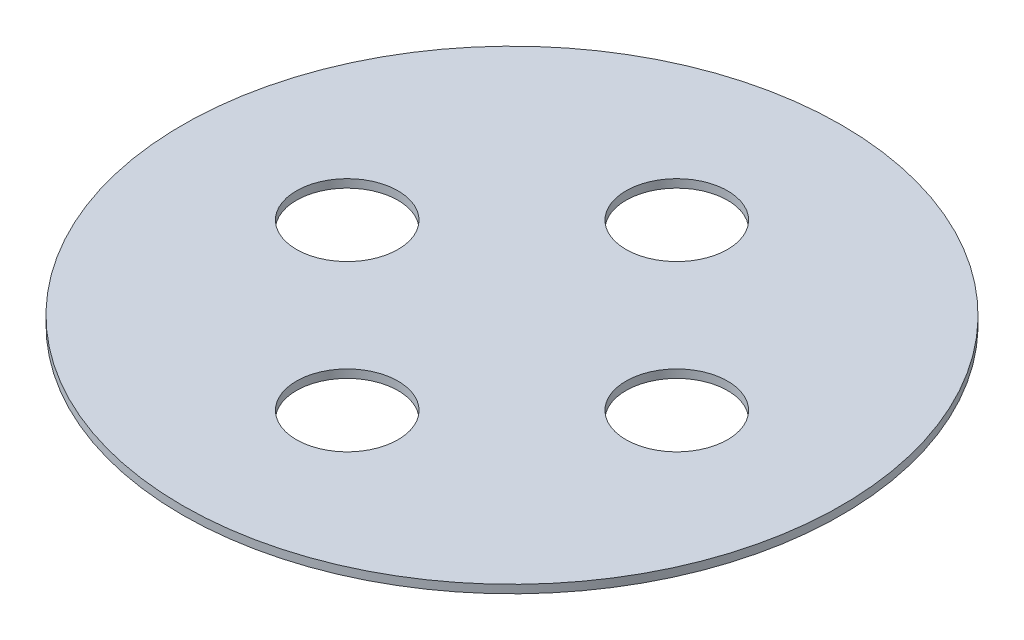
from build123d import *

# Parameters (mm, degrees)
SKETCH_1_R          = 9.9
SKETCH_1_R_2        = 1.85
EXTRUDE_1_DEPTH     = 7
SKETCH_2_R          = 12.5
SKETCH_2_R_2        = 1.85
EXTRUDE_2_DEPTH     = 2.5
SKETCH_3_R          = 3.75
EXTRUDE_3_DEPTH     = 6.3
CHAMFER_1_SIZE      = 2
SKETCH_4_R          = 41.5
CUT_EXTRUDE_1_DEPTH = 15.5
EXTRUDE_START       = -0.3
SKETCH_5_R          = 12
SKETCH_5_R_2        = 9.9
EXTRUDE_4_DEPTH     = 0.3


with BuildPart() as part:
    # 草图1 → 凸台-拉伸1 (new body)
    with BuildSketch(Plane(origin=(0, 0, 0), x_dir=(1, 0, 0), z_dir=(0, 1, 0))):
        with Locations(Location((0, 0, 0), (0, 0, 270))):
            Circle(SKETCH_1_R)
        with Locations(Location((6, 0, 0), (0, 0, 270))):
            Circle(SKETCH_1_R_2, mode=Mode.SUBTRACT)
        with Locations(Location((0, -6, 0), (0, 0, 270))):
            Circle(SKETCH_1_R_2, mode=Mode.SUBTRACT)
        with Locations(Location((-6, 0, 0), (0, 0, 270))):
            Circle(SKETCH_1_R_2, mode=Mode.SUBTRACT)
        with Locations(Location((0, 6, 0), (0, 0, 270))):
            Circle(SKETCH_1_R_2, mode=Mode.SUBTRACT)
    extrude(amount=EXTRUDE_1_DEPTH)

    # 草图2 → 凸台-拉伸2 (add)
    with BuildSketch(Plane(origin=(0, 7, 0), x_dir=(1, 0, 0), z_dir=(0, 1, 0))):
        with Locations(Location((0, 0, 0), (0, 0, 270))):
            Circle(SKETCH_2_R)
        with Locations(Location((-6, 0, 0), (0, 0, 270))):
            Circle(SKETCH_2_R_2, mode=Mode.SUBTRACT)
        with Locations(Location((0, -6, 0), (0, 0, 270))):
            Circle(SKETCH_2_R_2, mode=Mode.SUBTRACT)
        with Locations(Location((6, 0, 0), (0, 0, 270))):
            Circle(SKETCH_2_R_2, mode=Mode.SUBTRACT)
        with Locations(Location((0, 6, 0), (0, 0, 270))):
            Circle(SKETCH_2_R_2, mode=Mode.SUBTRACT)
    extrude(amount=EXTRUDE_2_DEPTH)

    # 草图3 → 凸台-拉伸3 (add)
    # profile 1 of 8: a face of its own
    with BuildSketch(Plane(origin=(0, 9.5, 0), x_dir=(1, 0, 0), z_dir=(0, 1, 0))):
        with BuildLine():
            Line((2.25, 0), (-2.25, 0))
            ThreePointArc((-2.25, 0), (-6, -3.75), (-9.75, 0))
            Line((-9.75, 0), (-12.5, 0))
            ThreePointArc((-12.5, 0), (-3.952847075, -11.858541226), (10, -7.5))
            ThreePointArc((10, -7.5), (11.858541226, -3.952847075), (12.5, 0))
            Line((12.5, 0), (9.75, 0))
            ThreePointArc((9.75, 0), (6, -3.75), (2.25, 0))
        make_face()
        with Locations(Location((0, -6, 0), (0, 0, 270))):
            Circle(SKETCH_3_R, mode=Mode.SUBTRACT)
    # profile 2 of 8: a face of its own
    with BuildSketch(Plane(origin=(0, 9.5, 0), x_dir=(1, 0, 0), z_dir=(0, 1, 0))):
        with BuildLine():
            ThreePointArc((-9.75, 0), (-6, 3.75), (-2.25, 0))
            Line((-2.25, 0), (2.25, 0))
            ThreePointArc((2.25, 0), (6, 3.75), (9.75, 0))
            Line((9.75, 0), (12.5, 0))
            ThreePointArc((12.5, 0), (11.858541226, 3.952847075), (10, 7.5))
            ThreePointArc((10, 7.5), (-3.952847075, 11.858541226), (-12.5, 0))
            Line((-12.5, 0), (-9.75, 0))
        make_face()
        with Locations(Location((0, 6, 0), (0, 0, 270))):
            Circle(SKETCH_3_R, mode=Mode.SUBTRACT)
    # profile 3 of 8: a face of its own
    with BuildSketch(Plane(origin=(0, 9.5, 0), x_dir=(1, 0, 0), z_dir=(0, 1, 0))):
        with BuildLine():
            ThreePointArc((10, 7.5), (11.858541226, 3.952847075), (12.5, 0))
            Line((12.5, 0), (25.5, 0))
            ThreePointArc((25.5, 0), (27.696699141, 5.303300859), (33, 7.5))
            Line((33, 7.5), (10, 7.5))
        make_face()
    # profile 4 of 8: a face of its own
    with BuildSketch(Plane(origin=(0, 9.5, 0), x_dir=(1, 0, 0), z_dir=(0, 1, 0))):
        with BuildLine():
            Line((25.5, 0), (12.5, 0))
            ThreePointArc((12.5, 0), (11.858541226, -3.952847075), (10, -7.5))
            Line((10, -7.5), (33, -7.5))
            ThreePointArc((33, -7.5), (27.696699141, -5.303300859), (25.5, 0))
        make_face()
    # profile 5 of 8: a face of its own
    with BuildSketch(Plane(origin=(0, 9.5, 0), x_dir=(1, 0, 0), z_dir=(0, 1, 0))):
        with BuildLine():
            ThreePointArc((33, 7.5), (27.696699141, 5.303300859), (25.5, 0))
            Line((25.5, 0), (28.65, 0))
            ThreePointArc((28.65, 0), (33, 4.35), (37.35, 0))
            Line((37.35, 0), (40.5, 0))
            ThreePointArc((40.5, 0), (38.303300859, 5.303300859), (33, 7.5))
        make_face()
    # profile 6 of 8: a face of its own
    with BuildSketch(Plane(origin=(0, 9.5, 0), x_dir=(1, 0, 0), z_dir=(0, 1, 0))):
        with BuildLine():
            Line((28.65, 0), (25.5, 0))
            ThreePointArc((25.5, 0), (27.696699141, -5.303300859), (33, -7.5))
            ThreePointArc((33, -7.5), (38.303300859, -5.303300859), (40.5, 0))
            Line((40.5, 0), (37.35, 0))
            ThreePointArc((37.35, 0), (33, -4.35), (28.65, 0))
        make_face()
    # profile 7 of 8: a face of its own
    with BuildSketch(Plane(origin=(0, 9.5, 0), x_dir=(1, 0, 0), z_dir=(0, 1, 0))):
        with BuildLine():
            ThreePointArc((33, 7.5), (27.696699141, 5.303300859), (25.5, 0))
            Line((25.5, 0), (28.65, 0))
            ThreePointArc((28.65, 0), (33, 4.35), (37.35, 0))
            Line((37.35, 0), (40.5, 0))
            ThreePointArc((40.5, 0), (38.303300859, 5.303300859), (33, 7.5))
        make_face()
    # profile 8 of 8: a face of its own
    with BuildSketch(Plane(origin=(0, 9.5, 0), x_dir=(1, 0, 0), z_dir=(0, 1, 0))):
        with BuildLine():
            Line((28.65, 0), (25.5, 0))
            ThreePointArc((25.5, 0), (27.696699141, -5.303300859), (33, -7.5))
            ThreePointArc((33, -7.5), (38.303300859, -5.303300859), (40.5, 0))
            Line((40.5, 0), (37.35, 0))
            ThreePointArc((37.35, 0), (33, -4.35), (28.65, 0))
        make_face()
    extrude(amount=EXTRUDE_3_DEPTH)

    # 倒角1
    # the kernel refuses this chamfer: 2 mm, written as the material it adds along each edge
    with BuildSketch(Plane(origin=(0, 9.5, 6), x_dir=(0, 0, 1), z_dir=(-1, 0, 0))) as chamfer_1_piece_1_section:
        Polygon((3.75 - CHAMFER_1_SIZE, 0), (3.75, CHAMFER_1_SIZE), (3.75, 0), align=None)
    chamfer_1_piece_1 = revolve(axis=Axis((0, 9.5, 6), (0, 1, 0)), mode=Mode.PRIVATE)
    chamfer_1_piece_1 = chamfer_1_piece_1 - Plane(origin=(0, 10.553600351, 6), x_dir=(0, 0, 1), z_dir=(0, -1, 0)) * Cylinder(1.85, 15, mode=Mode.PRIVATE)
    add(chamfer_1_piece_1)
    with BuildSketch(Plane(origin=(-6, 9.5, 0), x_dir=(-1, 0, 0), z_dir=(0, 0, 1))) as chamfer_1_piece_2_section:
        Polygon((3.75 - CHAMFER_1_SIZE, 0), (3.75, -CHAMFER_1_SIZE), (3.75, 0), align=None)
    chamfer_1_piece_2 = revolve(axis=Axis((-6, 9.5, 0), (0, -1, 0)), mode=Mode.PRIVATE)
    chamfer_1_piece_2 = chamfer_1_piece_2 - Plane(origin=(-6, 10.553600351, 0), x_dir=(0, 0, 1), z_dir=(0, -1, 0)) * Cylinder(1.85, 15, mode=Mode.PRIVATE)
    add(chamfer_1_piece_2)
    with BuildSketch(Plane(origin=(0, 9.5, -6), x_dir=(0, 0, 1), z_dir=(-1, 0, 0))) as chamfer_1_piece_3_section:
        Polygon((3.75 - CHAMFER_1_SIZE, 0), (3.75, CHAMFER_1_SIZE), (3.75, 0), align=None)
    chamfer_1_piece_3 = revolve(axis=Axis((0, 9.5, -6), (0, 1, 0)), mode=Mode.PRIVATE)
    chamfer_1_piece_3 = chamfer_1_piece_3 - Plane(origin=(0, 10.553600351, -6), x_dir=(0, 0, 1), z_dir=(0, -1, 0)) * Cylinder(1.85, 16, mode=Mode.PRIVATE)
    add(chamfer_1_piece_3)
    with BuildSketch(Plane(origin=(6, 9.5, 0), x_dir=(1, 0, 0), z_dir=(0, 0, -1))) as chamfer_1_piece_4_section:
        Polygon((3.75 - CHAMFER_1_SIZE, 0), (3.75, -CHAMFER_1_SIZE), (3.75, 0), align=None)
    chamfer_1_piece_4 = revolve(axis=Axis((6, 9.5, 0), (0, -1, 0)), mode=Mode.PRIVATE)
    chamfer_1_piece_4 = chamfer_1_piece_4 - Plane(origin=(6, 10.553600351, 0), x_dir=(0, 0, 1), z_dir=(0, -1, 0)) * Cylinder(1.85, 15, mode=Mode.PRIVATE)
    add(chamfer_1_piece_4)

    # 草图4 → 切除-拉伸1 (cut)
    with BuildSketch(Plane(origin=(0, 15.8, 0), x_dir=(1, 0, 0), z_dir=(0, 1, 0))):
        Circle(SKETCH_4_R)
    extrude(amount=-CUT_EXTRUDE_1_DEPTH, mode=Mode.SUBTRACT)

    # 草图5 → 凸台-拉伸4 (add)
    with BuildSketch(Plane(origin=(0, 0.3, 0), x_dir=(1, 0, 0), z_dir=(0, 1, 0)).offset(EXTRUDE_START)):
        with Locations(Location((0, 0, 0), (0, 0, 270))):
            Circle(SKETCH_5_R)
        Circle(SKETCH_5_R_2, mode=Mode.SUBTRACT)
    extrude(amount=EXTRUDE_4_DEPTH)


solid = part.part
